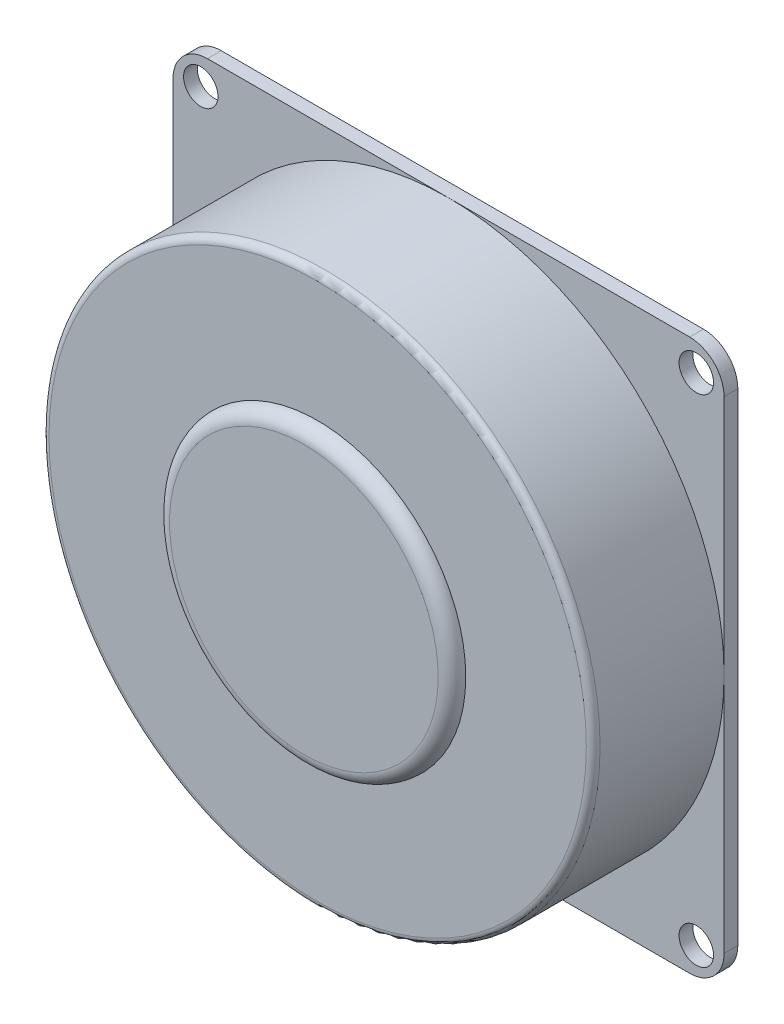
from build123d import *

# Parameters (mm, degrees)
ESQUISSE1_W        = 80
ESQUISSE1_H        = 80
ESQUISSE1_R        = 2.5
BOSS_EXTRU_1_DEPTH = 2
ESQUISSE2_R        = 40
BOSS_EXTRU_2_DEPTH = 19
ESQUISSE3_R        = 21.5
BOSS_EXTRU_3_DEPTH = 2
CONG_1_R           = 5
CONG_2_R           = 2
CONG_3_R           = 1


with BuildPart() as part:
    # Esquisse1 → Boss.-Extru.1 (new body)
    with BuildSketch(Plane.XY):
        with Locations((5.633683954, -6.21564482)):
            Rectangle(ESQUISSE1_W, ESQUISSE1_H)
        with Locations((-30.337555091, 29.78435518)):
            Circle(ESQUISSE1_R, mode=Mode.SUBTRACT)
        with Locations((-30.337555091, -42.21564482)):
            Circle(ESQUISSE1_R, mode=Mode.SUBTRACT)
        with Locations(Location((41.604923, -42.21564482, 0), (0, 0, 180))):
            Circle(ESQUISSE1_R, mode=Mode.SUBTRACT)
        with Locations(Location((41.604923, 29.78435518, 0), (0, 0, 180))):
            Circle(ESQUISSE1_R, mode=Mode.SUBTRACT)
    extrude(amount=BOSS_EXTRU_1_DEPTH)

    # Esquisse2 → Boss.-Extru.2 (add)
    with BuildSketch(Plane.XY.offset(2)):
        with Locations((5.633683954, -6.21564482)):
            Circle(ESQUISSE2_R)
    extrude(amount=BOSS_EXTRU_2_DEPTH)

    # Esquisse3 → Boss.-Extru.3 (add)
    with BuildSketch(Plane.XY.offset(21)):
        with Locations((5.633683954, -6.21564482)):
            Circle(ESQUISSE3_R)
    extrude(amount=BOSS_EXTRU_3_DEPTH)

    # Congé1
    cong_1_edges = [part.edges().sort_by_distance(p)[0] for p in [
        (-34.366316046, 33.78435518, 1),
        (45.633683954, 33.78435518, 1),
        (45.633683954, -46.21564482, 1),
        (-34.366316046, -46.21564482, 1),
    ]]
    fillet(cong_1_edges, radius=CONG_1_R)

    # Congé2
    cong_2_edges = [part.edges().sort_by_distance(p)[0] for p in [
        (-15.866316046, -6.21564482, 23),
    ]]
    fillet(cong_2_edges, radius=CONG_2_R - 0.0001)  # a hair under: the kernel refuses the full size

    # Congé3
    cong_3_edges = [part.edges().sort_by_distance(p)[0] for p in [
        (-34.366316046, -6.21564482, 21),
    ]]
    fillet(cong_3_edges, radius=CONG_3_R)


solid = part.part
